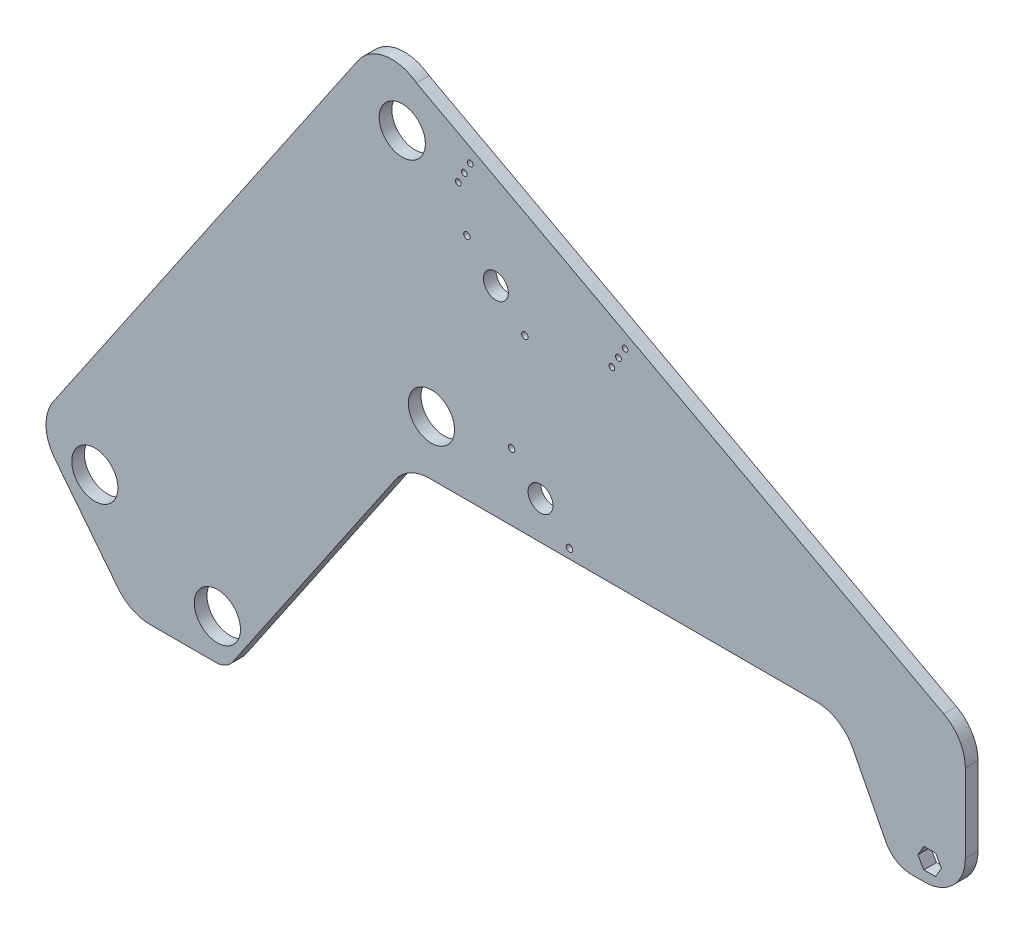
from build123d import *

# Parameters (mm, degrees)
MODEL_R             = 14.351
MODEL_R_2           = 2.032
MODEL_R_3           = 7.747
MODEL_R_4           = 1.778
BOSS_EXTRUDE1_DEPTH = 7.874


with BuildPart() as part:
    # Model → Boss-Extrude1 (new body)
    with BuildSketch(Plane.XY):
        with BuildLine():
            ThreePointArc((-212.899365952, 93.541257838), (-203.778989185, 101.701881024), (-191.901103209, 104.650248016))
            Line((-191.901103209, 104.650248016), (48.661197018, 104.650248016))
            ThreePointArc((48.661197018, 104.650248016), (61.901986038, 100.926075708), (71.260020742, 90.8456422))
            Line((71.260020742, 90.8456422), (91.800416921, 50.813472087))
            ThreePointArc((91.800416921, 50.813472087), (98.351041215, 43.757168632), (107.619593528, 41.150248016))
            Line((107.619593528, 41.150248016), (115.808590566, 41.150248016))
            ThreePointArc((115.808590566, 41.150248016), (133.769102808, 48.589735774), (141.208590566, 66.550248016))
            Line((141.208590566, 66.550248016), (141.208590566, 115.30333804))
            ThreePointArc((141.208590566, 115.30333804), (137.602779127, 128.348388632), (127.809114586, 137.689660276))
            Line((127.809114586, 137.689660276), (-200.005250584, 313.419470721))
            ThreePointArc((-200.005250584, 313.419470721), (-219.438743814, 318.210854709), (-236.308771814, 307.439588539))
            Line((-236.308771814, 307.439588539), (-425.925316767, 28.829603592))
            ThreePointArc((-425.925316767, 28.829603592), (-430.312243104, 13.671313347), (-424.900993017, -1.152223962))
            Line((-424.900993017, -1.152223962), (-385.581467186, -51.204797614))
            ThreePointArc((-385.581467186, -51.204797614), (-376.711879358, -58.358090396), (-365.607528193, -60.913979882))
            Line((-365.607528193, -60.913979882), (-324.737451002, -60.913979882))
            ThreePointArc((-324.737451002, -60.913979882), (-318.798508014, -59.439796386), (-314.23831963, -55.359484793))
            Line((-314.23831963, -55.359484793), (-212.899365952, 93.541257838))
        make_face()
        with Locations((-323.775189267, -35.513979882)):
            Circle(MODEL_R, mode=Mode.SUBTRACT)
        with Locations((-399.975189267, 2.586020118)):
            Circle(MODEL_R, mode=Mode.SUBTRACT)
        with BuildLine():
            ThreePointArc((-106.906627247, 110.457357488), (-106.315772458, 111.902007888), (-104.874663217, 112.501447888))
            ThreePointArc((-104.874663217, 112.501447888), (-103.433553975, 109.036887888), (-106.906627247, 110.457357488))
        make_face(mode=Mode.SUBTRACT)
        Polygon((122.716975548, 60.200248016), (126.383149757, 53.850248016), (122.716975548, 47.500248016), (115.384627129, 47.500248016), (111.71845292, 53.850248016), (115.384627129, 60.200248016), align=None, mode=Mode.SUBTRACT)
        with Locations((-190.707148919, 138.516914683)):
            Circle(MODEL_R, mode=Mode.SUBTRACT)
        with Locations((-140.902394258, 146.283447888)):
            Circle(MODEL_R_2, mode=Mode.SUBTRACT)
        with Locations((-122.888528737, 128.249447888)):
            Circle(MODEL_R_3, mode=Mode.SUBTRACT)
        with BuildLine():
            ThreePointArc((-134.653486697, 211.157153967), (-134.062631908, 212.601804367), (-132.621522666, 213.201244367))
            ThreePointArc((-132.621522666, 213.201244367), (-131.180413424, 209.736684367), (-134.653486697, 211.157153967))
        make_face(mode=Mode.SUBTRACT)
        with Locations((-78.52871608, 221.22316596)):
            Circle(MODEL_R_4, mode=Mode.SUBTRACT)
        with Locations((-150.635388187, 228.949244367)):
            Circle(MODEL_R_3, mode=Mode.SUBTRACT)
        with Locations((-168.649253708, 246.983244367)):
            Circle(MODEL_R_2, mode=Mode.SUBTRACT)
        with Locations((-74.433419274, 228.244058216)):
            Circle(MODEL_R_4, mode=Mode.SUBTRACT)
        with Locations((-70.338122468, 235.264950472)):
            Circle(MODEL_R_4, mode=Mode.SUBTRACT)
        with Locations((-208.832932893, 283.437784316)):
            Circle(MODEL_R, mode=Mode.SUBTRACT)
        with Locations((-174.016833832, 272.974157288)):
            Circle(MODEL_R_4, mode=Mode.SUBTRACT)
        with Locations((-170.296671386, 279.913917181)):
            Circle(MODEL_R_4, mode=Mode.SUBTRACT)
        with Locations((-166.57650894, 286.853677074)):
            Circle(MODEL_R_4, mode=Mode.SUBTRACT)
    extrude(amount=BOSS_EXTRUDE1_DEPTH)


solid = part.part
